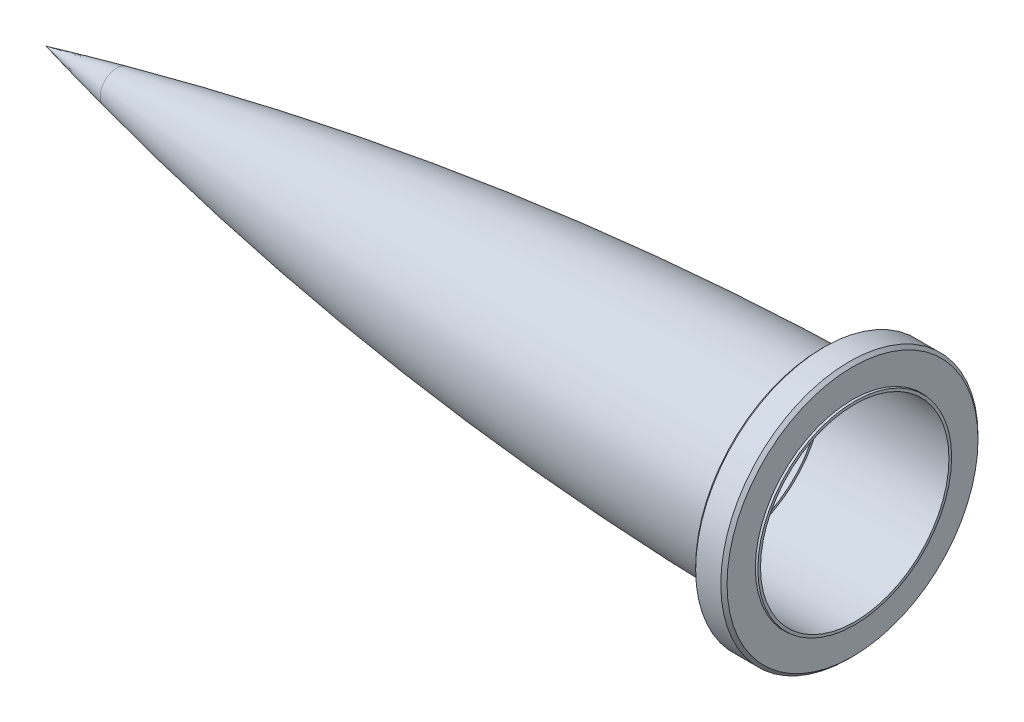
from build123d import *

# Parameters (mm, degrees)
OGIVE_SHELL_T      = -2.159
SKETCH1_R          = 2.5527
CUT_EXTRUDE1_DEPTH = 25.4
SKETCH2_R          = 76.2
CUT_EXTRUDE4_DEPTH = 101.6
CHAMFER1_SIZE      = 2.54


# Read off the part's stored shape, not the designer's step: Ogive Nose Cone Revolve
with BuildPart() as part:
    # Ogive Sketch → Ogive Body Revolve (revolve)
    with BuildSketch(Plane.XY, mode=Mode.PRIVATE) as ogive_body_revolve_sk:
        with BuildLine():
            Line((57.15, 0), (654.05, 0))
            Line((654.05, 0), (654.05, 78.359))
            ThreePointArc((654.05, 78.359), (353.829945599, 62.034524409), (57.15, 13.253591171))
            Line((57.15, 13.253591171), (57.15, 0))
        make_face()
    revolve(ogive_body_revolve_sk.sketch.rotate(Axis((0, 0, 0), (1, 0, 0)), 90), axis=Axis((0, 0, 0), (1, 0, 0)))

    # Ogive Shell
    ogive_shell_openings = [part.faces().sort_by_distance(p)[0] for p in [
        (57.15, 0, 0),
        (654.05, 0, 0),
    ]]
    offset(amount=OGIVE_SHELL_T, openings=ogive_shell_openings, kind=Kind.INTERSECTION)

    # Sketch2 → Cut-Extrude4 (cut)
    with BuildSketch(Plane(origin=(654.05, 0, 0), x_dir=(0, 0, -1), z_dir=(1, 0, 0))):
        Circle(SKETCH2_R)
    extrude(amount=-CUT_EXTRUDE4_DEPTH, mode=Mode.SUBTRACT)


with BuildPart() as body_2:
    # Ogive Nose Cone Revolve outline → Ogive Nose Cone Revolve (revolve)
    with BuildSketch(Plane.YX):
        with BuildLine():
            add(Edge.make_bspline(
                [(13.253591171, 57.15), (6.929542592, 28.504790288), (0, 0)],
                knots=[0.217286158, 0.217286158, 0.217286158, 0.238475007, 0.238475007, 0.238475007], degree=2, weights=[1, 0.99994388, 1]))
            Line((13.253591171, 57.15), (0, 57.15))
            Line((0, 57.15), (0, 0))
        make_face()
    revolve(axis=Axis((0, 0, 0), (1, 0, 0)))

    # Sketch1 → Cut-Extrude1 (cut)
    with BuildSketch(Plane(origin=(57.15, 0, 0), x_dir=(0, 0, -1), z_dir=(1, 0, 0))):
        Circle(SKETCH1_R)
    extrude(amount=-CUT_EXTRUDE1_DEPTH, mode=Mode.SUBTRACT)


with BuildPart() as body_3:
    # Sketch3 → Revolve1 (revolve)
    with BuildSketch(Plane.XY, mode=Mode.PRIVATE) as revolve1_sk:
        with BuildLine():
            Line((652.272, 78.612429177), (652.272, 104.012429177))
            Line((652.272, 104.012429177), (626.872, 104.012429177))
            Line((626.872, 104.012429177), (626.872, 78.47962228))
            ThreePointArc((626.872, 78.47962228), (639.571847721, 78.575149895), (652.272, 78.612429177))
        make_face()
    revolve(revolve1_sk.sketch.rotate(Axis((0, 0, 0), (1, 0, 0)), 90), axis=Axis((0, 0, 0), (1, 0, 0)))

    # Chamfer1
    chamfer1_edges = [body_3.edges().sort_by_distance(p)[0] for p in [
        (626.872, 0, -104.012429177),
        (652.272, 0, -104.012429177),
    ]]
    chamfer(chamfer1_edges, length=CHAMFER1_SIZE)


solid = Compound([part.part, body_2.part, body_3.part])
